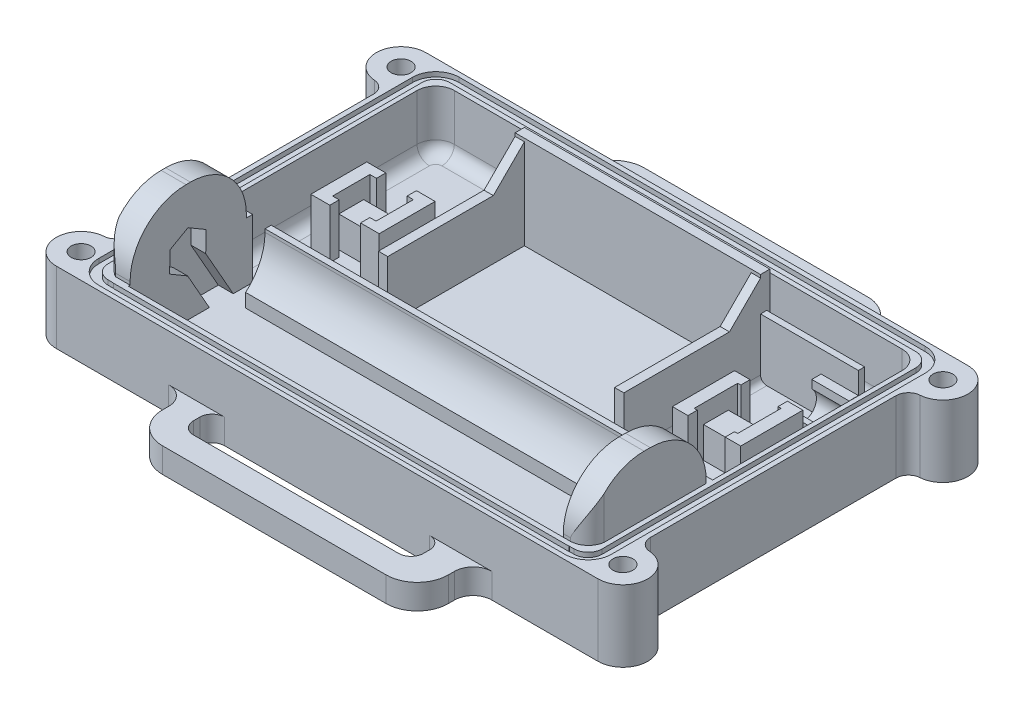
from build123d import *

# Parameters (mm, degrees)
SKETCH_7_R            = 1.6
EXTRUDE_4_DEPTH       = 2
SKETCH_8_R            = 1.6
EXTRUDE_5_DEPTH       = 9.5
CUT_EXTRUDE_1_DEPTH   = 0.75
SKETCH_10_W           = 70
SKETCH_10_H           = 19
EXTRUDE_6_DEPTH       = 9.5
SKETCH_11_W           = 4
SKETCH_11_H           = 18.716033259
SKETCH_11_H_2         = 18.996453255
EXTRUDE_7_DEPTH       = 9.5
FILLET_2_R            = 9
FILLET_3_R            = 9
EXTRUDE_8_DEPTH       = 9.5
SKETCH_14_W           = 7
SKETCH_14_H           = 4
EXTRUDE_9_DEPTH       = 5
FILLET_4_R            = 2
SKETCH_15_W           = 6
SKETCH_15_H           = 6
EXTRUDE_10_DEPTH      = 6
CUT_EXTRUDE_1_2_REACH = 94.706
CUT_EXTRUDE_2_DEPTH   = 2.4
SKETCH_18_W           = 3
SKETCH_18_H           = 1
CUT_EXTRUDE_3_DEPTH   = 9.5
CUT_EXTRUDE_4_REACH   = 72.155
SKETCH_19_W           = 2.4
SKETCH_19_H           = 3.348631561
CUT_EXTRUDE_5_DEPTH   = 3
EXTRUDE_11_DEPTH      = 4
FILLET_6_R            = 3
EXTRUDE_12_DEPTH      = 8
CHAMFER_1_SIZE        = 1.3
FILLET_7_R            = 1
CUT_EXTRUDE_6_DEPTH   = 75.390926866
SKETCH_26_W           = 39.5
SKETCH_26_H           = 1.5
EXTRUDE_14_DEPTH      = 15
CHAMFER_2_SIZE        = 5


with BuildPart() as part:
    # Эскиз7 → Бобышка-Вытянуть4 (new body)
    with BuildSketch(Plane(origin=(0, 0, 0), x_dir=(1, 0, 0), z_dir=(0, 1, 0))):
        with BuildLine():
            Line((-42.036363636, 37.015888806), (-42.036363636, -2.515888806))
            ThreePointArc((-42.036363636, -2.515888806), (-42.571626614, -3.877705775), (-43.890909091, -4.510592538))
            ThreePointArc((-43.890909091, -4.510592538), (-47.597350988, -8.645550937), (-43.6, -12.5))
            Line((-43.6, -12.5), (-42, -12.5))
            Line((-42, -12.5), (42, -12.5))
            Line((42, -12.5), (43.6, -12.5))
            ThreePointArc((43.6, -12.5), (47.597350988, -8.645550937), (43.890909091, -4.510592538))
            ThreePointArc((43.890909091, -4.510592538), (42.571626614, -3.877705775), (42.036363636, -2.515888806))
            Line((42.036363636, -2.515888806), (42.036363636, 37.015888806))
            ThreePointArc((42.036363636, 37.015888806), (42.571626614, 38.377705775), (43.890909091, 39.010592538))
            ThreePointArc((43.890909091, 39.010592538), (47.597350988, 43.145550937), (43.6, 47))
            Line((43.6, 47), (42, 47))
            Line((42, 47), (-42, 47))
            Line((-42, 47), (-43.6, 47))
            ThreePointArc((-43.6, 47), (-47.597350988, 43.145550937), (-43.890909091, 39.010592538))
            ThreePointArc((-43.890909091, 39.010592538), (-42.571626614, 38.377705775), (-42.036363636, 37.015888806))
        make_face()
        with Locations(Location((-43.6, 43, 0), (0, 0, 270))):
            Circle(SKETCH_7_R, mode=Mode.SUBTRACT)
        with Locations(Location((43.6, 43, 0), (0, 0, 90))):
            Circle(SKETCH_7_R, mode=Mode.SUBTRACT)
        with Locations(Location((43.6, -8.5, 0), (0, 0, 270))):
            Circle(SKETCH_7_R, mode=Mode.SUBTRACT)
        with Locations(Location((-43.6, -8.5, 0), (0, 0, 90))):
            Circle(SKETCH_7_R, mode=Mode.SUBTRACT)
    extrude(amount=EXTRUDE_4_DEPTH)

    # Эскиз8 → Бобышка-Вытянуть5 (add)
    with BuildSketch(Plane(origin=(0, 2, 0), x_dir=(1, 0, 0), z_dir=(0, 1, 0))):
        with BuildLine():
            Line((-43.6, -12.5), (43.6, -12.5))
            ThreePointArc((43.6, -12.5), (47.597350988, -8.645550937), (43.890909091, -4.510592538))
            ThreePointArc((43.890909091, -4.510592538), (42.571626614, -3.877705775), (42.036363636, -2.515888806))
            Line((42.036363636, -2.515888806), (42.036363636, 37.015888806))
            ThreePointArc((42.036363636, 37.015888806), (42.571626614, 38.377705775), (43.890909091, 39.010592538))
            ThreePointArc((43.890909091, 39.010592538), (47.597350988, 43.145550937), (43.6, 47))
            Line((43.6, 47), (-43.6, 47))
            ThreePointArc((-43.6, 47), (-47.597350988, 43.145550937), (-43.890909091, 39.010592538))
            ThreePointArc((-43.890909091, 39.010592538), (-42.571626614, 38.377705775), (-42.036363636, 37.015888806))
            Line((-42.036363636, 37.015888806), (-42.036363636, -2.515888806))
            ThreePointArc((-42.036363636, -2.515888806), (-42.571626614, -3.877705775), (-43.890909091, -4.510592538))
            ThreePointArc((-43.890909091, -4.510592538), (-47.597350988, -8.645550937), (-43.6, -12.5))
        make_face()
        with Locations(Location((43.6, -8.5, 0), (0, 0, 270))):
            Circle(SKETCH_8_R, mode=Mode.SUBTRACT)
        with Locations(Location((-43.6, -8.5, 0), (0, 0, 90))):
            Circle(SKETCH_8_R, mode=Mode.SUBTRACT)
        with Locations(Location((-43.6, 43, 0), (0, 0, 270))):
            Circle(SKETCH_8_R, mode=Mode.SUBTRACT)
        with Locations(Location((43.6, 43, 0), (0, 0, 90))):
            Circle(SKETCH_8_R, mode=Mode.SUBTRACT)
        with BuildLine():
            Line((-36.036363636, 44), (36.036363636, 44))
            ThreePointArc((36.036363636, 44), (38.15768398, 43.121320344), (39.036363636, 41))
            Line((39.036363636, 41), (39.036363636, -6.5))
            ThreePointArc((39.036363636, -6.5), (38.15768398, -8.621320344), (36.036363636, -9.5))
            Line((36.036363636, -9.5), (-36.036363636, -9.5))
            ThreePointArc((-36.036363636, -9.5), (-38.15768398, -8.621320344), (-39.036363636, -6.5))
            Line((-39.036363636, -6.5), (-39.036363636, 41))
            ThreePointArc((-39.036363636, 41), (-38.15768398, 43.121320344), (-36.036363636, 44))
        make_face(mode=Mode.SUBTRACT)
    extrude(amount=EXTRUDE_5_DEPTH)

    # Эскиз9 → Cut-Extrude 1 (cut)
    with BuildSketch(Plane(origin=(0, 11.5, 0), x_dir=(1, 0, 0), z_dir=(0, 1, 0))):
        with BuildLine():
            Line((41.25, -8), (41.25, 42.5))
            ThreePointArc((41.25, 42.5), (40.151650429, 45.151650429), (37.5, 46.25))
            Line((37.5, 46.25), (-37.5, 46.25))
            ThreePointArc((-37.5, 46.25), (-40.151650429, 45.151650429), (-41.25, 42.5))
            Line((-41.25, 42.5), (-41.25, -8))
            ThreePointArc((-41.25, -8), (-40.151650429, -10.651650429), (-37.5, -11.75))
            Line((-37.5, -11.75), (37.5, -11.75))
            ThreePointArc((37.5, -11.75), (40.151650429, -10.651650429), (41.25, -8))
        make_face()
        with BuildLine():
            Line((39.75, -8), (39.75, 42.5))
            ThreePointArc((39.75, 42.5), (39.090990258, 44.090990258), (37.5, 44.75))
            Line((37.5, 44.75), (-37.5, 44.75))
            ThreePointArc((-37.5, 44.75), (-39.090990258, 44.090990258), (-39.75, 42.5))
            Line((-39.75, 42.5), (-39.75, -8))
            ThreePointArc((-39.75, -8), (-39.090990258, -9.590990258), (-37.5, -10.25))
            Line((-37.5, -10.25), (37.5, -10.25))
            ThreePointArc((37.5, -10.25), (39.090990258, -9.590990258), (39.75, -8))
        make_face(mode=Mode.SUBTRACT)
    extrude(amount=-CUT_EXTRUDE_1_DEPTH, mode=Mode.SUBTRACT)

    # Эскиз10 → Бобышка-Вытянуть6 (add)
    with BuildSketch(Plane(origin=(0, 2, 0), x_dir=(1, 0, 0), z_dir=(0, 1, 0))):
        Polygon((-39.75, 10.5), (39.75, 10.5), (39.75, -7.248239252), (36.716857971, -10.281381281), (-36.602563383, -10.281381281), (-39.75, -7.637921573), align=None)
        Rectangle(SKETCH_10_W, SKETCH_10_H, mode=Mode.SUBTRACT)
    extrude(amount=EXTRUDE_6_DEPTH)

    # Эскиз11 → Бобышка-Вытянуть7 (add)
    with BuildSketch(Plane(origin=(0, 11.5, 0), x_dir=(1, 0, 0), z_dir=(0, 1, 0))):
        with Locations((-37, 0.14198337)):
            Rectangle(SKETCH_11_W, SKETCH_11_H)
        with Locations((37, 0.001773372)):
            Rectangle(SKETCH_11_W, SKETCH_11_H_2)
    extrude(amount=EXTRUDE_7_DEPTH)

    # Скругление2
    fillet_2_edges = [part.edges().sort_by_distance(p)[0] for p in [
        (-37, 21, -9.5),
        (-37, 21, 9.216033259),
        (37, 21, 9.496453255),
        (37, 21, -9.5),
    ]]
    fillet(fillet_2_edges, radius=FILLET_2_R)

    # Скругление3
    fillet_3_edges = [part.edges().sort_by_distance(p)[0] for p in [
        (0, 2, 9.5),
        (0, 2, -9.5),
    ]]
    fillet(fillet_3_edges, radius=FILLET_3_R)

    # Эскиз12 → Бобышка-Вытянуть8 (add)
    with BuildSketch(Plane(origin=(0, 2, 0), x_dir=(1, 0, 0), z_dir=(0, 1, 0))):
        Polygon((-19.75, 38.5), (-19.75, 37.5), (-19.75, 15.5), (-18.25, 15.5), (-18.25, 37.5), (18.25, 37.5), (18.25, 15.5), (19.75, 15.5), (19.75, 37.5), (35.5, 37.5), (35.5, 38.5), align=None)
    extrude(amount=EXTRUDE_8_DEPTH)

    # Эскиз14 → Бобышка-Вытянуть9 (add)
    with BuildSketch(Plane(origin=(0, 2, 0), x_dir=(1, 0, 0), z_dir=(0, 1, 0))):
        with Locations((-29.125, 24)):
            Rectangle(SKETCH_14_W, SKETCH_14_H)
        with Locations((29.566251917, 24)):
            Rectangle(SKETCH_14_W, SKETCH_14_H)
    extrude(amount=EXTRUDE_9_DEPTH)

    # Скругление4
    fillet_4_edges = [part.edges().sort_by_distance(p)[0] for p in [
        (39.036363636, 2, -25.75),
        (38.15768398, 2, -43.121320344),
        (0, 2, -44),
        (-38.15768398, 2, -43.121320344),
        (-39.036363636, 2, -25.75),
    ]]
    fillet(fillet_4_edges, radius=FILLET_4_R)

    # Эскиз15 → Бобышка-Вытянуть10 (add)
    with BuildSketch(Plane(origin=(0, 2, 0), x_dir=(1, 0, 0), z_dir=(0, 1, 0))):
        with Locations((32.5, 34.5)):
            Rectangle(SKETCH_15_W, SKETCH_15_H)
    extrude(amount=EXTRUDE_10_DEPTH)

    # Эскиз16 → Cut-Extrude 1 2 (cut, up to next)
    with BuildSketch(Plane.ZY.offset(-29.5), mode=Mode.PRIVATE) as cut_extrude_1_2_sk1:
        with BuildLine():
            Line((-33, 8), (-31.5, 8))
            Line((-31.5, 8), (-31.5, 5.798853887))
            Line((-31.5, 5.798853887), (-32.396590276, 5.798853887))
            ThreePointArc((-32.396590276, 5.798853887), (-35.032760132, 2.813983842), (-36, 6.677050983))
            Line((-36, 6.677050983), (-36, 8))
            Line((-36, 8), (-33, 8))
        make_face()
    cut_extrude_1_2_tool1 = extrude(cut_extrude_1_2_sk1.sketch, amount=-CUT_EXTRUDE_1_2_REACH, mode=Mode.PRIVATE) & part.part
    add(cut_extrude_1_2_tool1.solids().sort_by_distance((29.5, 5.59746, -34.182046))[0], mode=Mode.SUBTRACT)

    # Эскиз17 → Вырез-Вытянуть2 (cut)
    with BuildSketch(Plane(origin=(-35, 0, 0), x_dir=(0, 0, -1), z_dir=(1, 0, 0))):
        Polygon((2.958399224, 9.804060426), (2.983422209, 13.152598492), (0.096014671, 14.848538067), (-2.816415853, 13.195939574), (-2.841438839, 9.847401508), (0.0459687, 8.151461933), (3.253641336, 2.498471361), (6.16607186, 4.151069853), align=None)
    extrude(amount=-CUT_EXTRUDE_2_DEPTH, mode=Mode.SUBTRACT)

    # Эскиз18 → Вырез-Вытянуть3 (cut)
    with BuildSketch(Plane(origin=(0, 11.5, 0), x_dir=(1, 0, 0), z_dir=(0, 1, 0))):
        Polygon((-32, 9.5), (-35, 9.5), (-35, 5), (-35, 0.5), (-32, 0.5), (35, 0.5), (35, 6.380108776), (-32, 6.380108776), align=None)
        with Locations((-33.5, 10)):
            Rectangle(SKETCH_18_W, SKETCH_18_H)
    extrude(amount=-CUT_EXTRUDE_3_DEPTH, mode=Mode.SUBTRACT)

    # Вырез-Вытянуть4: up to this face of the body (flat: up to its plane)
    cut_extrude_4_end = Plane(part.part.faces().sort_by_distance((-0.777285813, 2, -21.547741514))[0])
    # Эскиз19 → Вырез-Вытянуть4 (cut, up to the picked face)
    with BuildSketch(Plane(origin=(0, 0.493397631, 0.279968286), x_dir=(1, 0, 0), z_dir=(0, 0.8697375242936732, 0.4935145781387944)), mode=Mode.PRIVATE) as cut_extrude_4_sk1:
        with Locations((-36.2, 5.737161782)):
            Rectangle(SKETCH_19_W, SKETCH_19_H)
    cut_extrude_4_tool1 = split(extrude(cut_extrude_4_sk1.sketch, amount=-CUT_EXTRUDE_4_REACH, mode=Mode.PRIVATE), bisect_by=cut_extrude_4_end, keep=Keep.BOTH, mode=Mode.PRIVATE)
    add(cut_extrude_4_tool1.solids().sort_by(Axis((-36.2, 3.324771, -4.709857), (0, -0.8697375242936732, -0.4935145781387944)))[0], mode=Mode.SUBTRACT)

    # Эскиз20 → Вырез-Вытянуть5 (cut)
    with BuildSketch(Plane.ZY.offset(-35)):
        with BuildLine():
            ThreePointArc((-2.466563676, 8.673817281), (-1.317887882, 7.988541244), (-0.001773373, 7.75))
            Line((-0.001773373, 7.75), (-0.001773373, 15.25))
            ThreePointArc((-0.001773373, 15.25), (-3.513232129, 12.81611451), (-2.466563676, 8.673817281))
        make_face()
        with BuildLine():
            Line((-0.001773373, 15.25), (-0.001773373, 7.75))
            ThreePointArc((-0.001773373, 7.75), (2.649877057, 8.848349571), (3.748226627, 11.5))
            ThreePointArc((3.748226627, 11.5), (2.649877057, 14.151650429), (-0.001773373, 15.25))
        make_face()
        with BuildLine():
            Line((-5.122260775, 2), (-0.001773373, 7.75))
            ThreePointArc((-0.001773373, 7.75), (-1.317887882, 7.988541244), (-2.466563676, 8.673817281))
            Line((-2.466563676, 8.673817281), (-6.380108776, 4.186460481))
            Line((-6.380108776, 4.186460481), (-6.380108776, 2))
            Line((-6.380108776, 2), (-5.122260775, 2))
        make_face()
    extrude(amount=-CUT_EXTRUDE_5_DEPTH, mode=Mode.SUBTRACT)

    # Эскиз22 → Бобышка-Вытянуть11 (add)
    # profile 1 of 2: a face of its own
    with BuildSketch(Plane.XZ):
        with BuildLine():
            Line((-22.5, 11.5), (23.5, 11.5))
            Line((23.5, 11.5), (23.5, 16.5))
            ThreePointArc((23.5, 16.5), (22.035533906, 20.035533906), (18.5, 21.5))
            Line((18.5, 21.5), (-17.5, 21.5))
            ThreePointArc((-17.5, 21.5), (-21.035533906, 20.035533906), (-22.5, 16.5))
            Line((-22.5, 16.5), (-22.5, 11.5))
        make_face()
        with BuildLine():
            Line((-16.5, 17.5), (16.5, 17.5))
            ThreePointArc((16.5, 17.5), (17.914213562, 16.914213562), (18.5, 15.5))
            Line((18.5, 15.5), (18.5, 14.5))
            ThreePointArc((18.5, 14.5), (17.914213562, 13.085786438), (16.5, 12.5))
            Line((16.5, 12.5), (-16.5, 12.5))
            ThreePointArc((-16.5, 12.5), (-17.914213562, 13.085786438), (-18.5, 14.5))
            Line((-18.5, 14.5), (-18.5, 15.5))
            ThreePointArc((-18.5, 15.5), (-17.914213562, 16.914213562), (-16.5, 17.5))
        make_face(mode=Mode.SUBTRACT)
    # profile 2 of 2: a face of its own
    with BuildSketch(Plane.XZ):
        with BuildLine():
            Line((23.5, -46), (23.5, -51))
            ThreePointArc((23.5, -51), (22.035533906, -54.535533906), (18.5, -56))
            Line((18.5, -56), (-17.5, -56))
            ThreePointArc((-17.5, -56), (-21.035533906, -54.535533906), (-22.5, -51))
            Line((-22.5, -51), (-22.5, -46))
            Line((-22.5, -46), (23.5, -46))
        make_face()
        with BuildLine():
            Line((18.5, -50), (18.5, -49))
            ThreePointArc((18.5, -49), (17.914213562, -47.585786438), (16.5, -47))
            Line((16.5, -47), (-16.5, -47))
            ThreePointArc((-16.5, -47), (-17.914213562, -47.585786438), (-18.5, -49))
            Line((-18.5, -49), (-18.5, -50))
            ThreePointArc((-18.5, -50), (-17.914213562, -51.414213562), (-16.5, -52))
            Line((-16.5, -52), (16.5, -52))
            ThreePointArc((16.5, -52), (17.914213562, -51.414213562), (18.5, -50))
        make_face(mode=Mode.SUBTRACT)
    extrude(amount=-EXTRUDE_11_DEPTH)

    # Скругление6
    fillet_6_edges = [part.edges().sort_by_distance(p)[0] for p in [
        (23.5, 2, 12.5),
        (-22.5, 2, 12.5),
        (23.5, 2, -47),
        (-22.5, 2, -47),
    ]]
    fillet(fillet_6_edges, radius=FILLET_6_R)

    # Эскиз23 → Бобышка-Вытянуть12 (add)
    with BuildSketch(Plane(origin=(0, 2, 0), x_dir=(1, 0, 0), z_dir=(0, 1, 0))):
        Polygon((-31.566702007, 28.5), (-31.566702007, 27), (-32.625, 27), (-32.625, 21), (-31.566702007, 21), (-31.566702007, 19.5), (-34.625, 19.5), (-34.625, 28.5), align=None)
        Polygon((-25.625, 27), (-25.625, 21), (-26.625, 21), (-26.625, 19.5), (-23.625, 19.5), (-23.625, 28.5), (-26.625, 28.5), (-26.625, 27), align=None)
        Polygon((26.566251917, 29.003984791), (26.566251917, 27.5), (26.066251917, 27.5), (26.066251917, 20.5), (26.566251917, 20.5), (26.566251917, 18.996015209), (24.066251917, 18.996015209), (24.066251917, 29.003984791), align=None)
        Polygon((33.066251917, 27.5), (33.066251917, 20.5), (32.566251917, 20.5), (32.566251917, 18.996015209), (35.066251917, 18.996015209), (35.066251917, 29.003984791), (32.566251917, 29.003984791), (32.566251917, 27.5), align=None)
    extrude(amount=EXTRUDE_12_DEPTH)

    # Фаска1
    chamfer_1_edges = [part.edges().sort_by_distance(p)[0] for p in [
        (-43.6, 0, -44.6),
        (43.6, 0, -41.4),
        (43.6, 0, 6.9),
        (-43.6, 0, 10.1),
    ]]
    chamfer(chamfer_1_edges, length=CHAMFER_1_SIZE)

    # Скругление7
    fillet_7_edges = [part.edges().sort_by_distance(p)[0] for p in [
        (19.75, 2, -26.5),
        (-19.75, 2, -27),
    ]]
    fillet(fillet_7_edges, radius=FILLET_7_R)

    # Эскиз24 → Вырез-Вытянуть6 (cut, through all)
    with BuildSketch(Plane(origin=(0, 11.5, 0), x_dir=(1, 0, 0), z_dir=(0, 1, 0))):
        with BuildLine():
            Line((-39.036363636, -6.5), (-40.40675074, -6.5))
            Line((-40.40675074, -6.5), (-40.40675074, -10.369240413))
            Line((-40.40675074, -10.369240413), (-36.036363636, -10.281381281))
            Line((-36.036363636, -10.281381281), (-36.036363636, -9.5))
            ThreePointArc((-36.036363636, -9.5), (-38.15768398, -8.621320344), (-39.036363636, -6.5))
        make_face()
        with BuildLine():
            Line((39.036363636, -6.5), (40.50924184, -6.5))
            Line((40.50924184, -6.5), (40.50924184, -11.377860228))
            Line((40.50924184, -11.377860228), (36.036363636, -11.377860228))
            Line((36.036363636, -11.377860228), (36.036363636, -9.5))
            ThreePointArc((36.036363636, -9.5), (38.15768398, -8.621320344), (39.036363636, -6.5))
        make_face()
    extrude(amount=CUT_EXTRUDE_6_DEPTH, mode=Mode.SUBTRACT)

    # Эскиз26 → Бобышка-Вытянуть14 (add)
    with BuildSketch(Plane(origin=(0, 2, 0), x_dir=(1, 0, 0), z_dir=(0, 1, 0))):
        with Locations((0, 38.25)):
            Rectangle(SKETCH_26_W, SKETCH_26_H)
    extrude(amount=EXTRUDE_14_DEPTH)

    # Фаска2
    # the kernel refuses this chamfer: 5 mm, written as the material it adds along each edge
    with BuildSketch(Plane(origin=(-19.75, 11.5, -37.5), x_dir=(0, 0.9996219169112968, -0.0274958766105877), z_dir=(1, 0, 0))) as chamfer_2_piece_1:
        Polygon((CHAMFER_2_SIZE * 0.999621916911, CHAMFER_2_SIZE * 0.0274958766106), (-CHAMFER_2_SIZE * 0.0274958766106, CHAMFER_2_SIZE * 0.999621916911), (0, 0), align=None)
    extrude(amount=1.5)
    with BuildSketch(Plane(origin=(18.25, 11.5, -37.5), x_dir=(0, -0.027495876610586317, 0.9996219169112968), z_dir=(1, 0, 0))) as chamfer_2_piece_2:
        Polygon((CHAMFER_2_SIZE * 0.999621916911, -CHAMFER_2_SIZE * 0.0274958766106), (-CHAMFER_2_SIZE * 0.0274958766106, -CHAMFER_2_SIZE * 0.999621916911), (0, 0), align=None)
    extrude(amount=1.5)


solid = part.part
